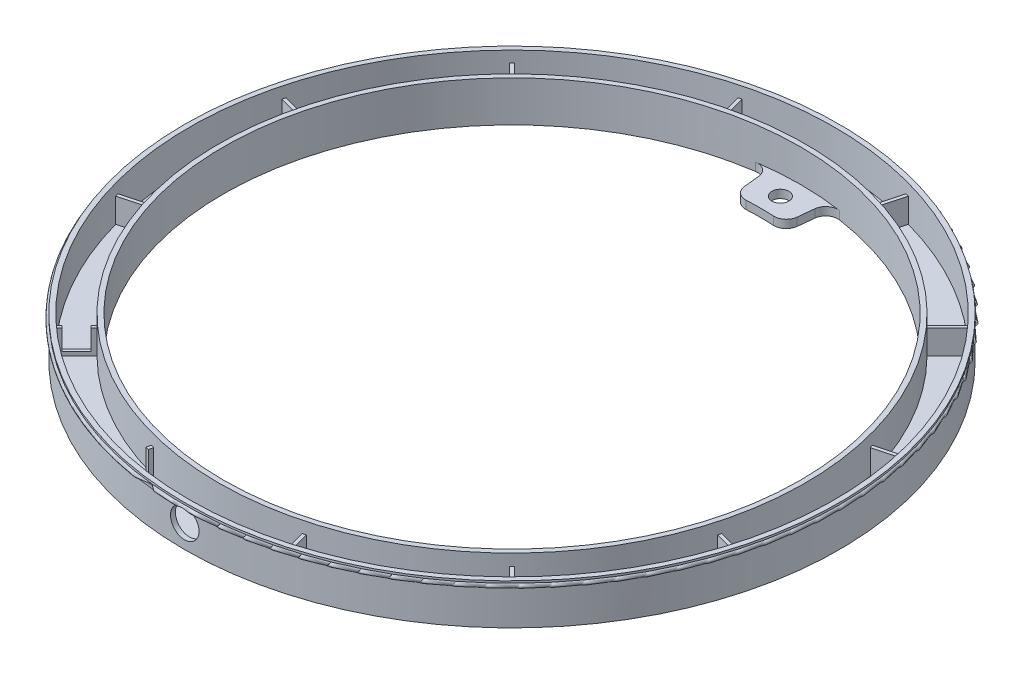
from build123d import *

# Parameters (mm, degrees)
RING_BASE_R         = 80.34
RING_BASE_R_2       = 70.79
BOSS_EXTRUDE1_DEPTH = 10
CUT_EXTRUDE1_START  = 1.2
CHANNEL_R           = 79.14
CHANNEL_R_2         = 71.99
CUT_EXTRUDE1_DEPTH  = 10
BOSS_EXTRUDE2_DEPTH = 6
CRVPATTERN2_COUNT   = 12
BOSS_EXTRUDE3_DEPTH = 2
SKETCH7_R           = 2.1
CUT_EXTRUDE3_DEPTH  = 2
FILLET1_R           = 3
FILLET2_R           = 3
CUT_EXTRUDE4_START  = 78
CUT_EXTRUDE4_DEPTH  = 4
SKETCH16_W          = 5
SKETCH16_H          = 5
CUT_EXTRUDE5_DEPTH  = 3
SKETCH17_W          = 5
SKETCH17_H          = 5
CUT_EXTRUDE6_DEPTH  = 3


with BuildPart() as part:
    # Ring Base → Boss-Extrude1 (new body)
    with BuildSketch(Plane(origin=(0, 0, 0), x_dir=(1, 0, 0), z_dir=(0, 1, 0))):
        with Locations(Location((0, 0, 0), (0, 0, 270))):
            Circle(RING_BASE_R)
        with Locations(Location((0, 0, 0), (0, 0, 270))):
            Circle(RING_BASE_R_2, mode=Mode.SUBTRACT)
    extrude(amount=BOSS_EXTRUDE1_DEPTH)

    # Channel → Cut-Extrude1 (cut)
    with BuildSketch(Plane(origin=(0, 0, 0), x_dir=(1, 0, 0), z_dir=(0, 1, 0)).offset(CUT_EXTRUDE1_START)):
        with Locations(Location((0, 0, 0), (0, 0, 270))):
            Circle(CHANNEL_R)
        with Locations(Location((0, 0, 0), (0, 0, 270))):
            Circle(CHANNEL_R_2, mode=Mode.SUBTRACT)
    extrude(amount=CUT_EXTRUDE1_DEPTH, mode=Mode.SUBTRACT)

    # Sketch3 → Boss-Extrude2 (add)
    with BuildSketch(Plane(origin=(0, 1.2, 0), x_dir=(1, 0, 0), z_dir=(0, 1, 0))):
        with BuildLine():
            Line((-20.201134269, 76.937140785), (-18.093262133, 69.070454876))
            Line((-18.093262133, 69.070454876), (-18.866002794, 68.86339964))
            Line((-18.866002794, 68.86339964), (-20.97387493, 76.730085549))
            Line((-20.97387493, 76.730085549), (-21.179634689, 77.497991422))
            ThreePointArc((-21.179634689, 77.497991422), (-20.793522084, 77.602480884), (-20.406894028, 77.705046658))
            Line((-20.406894028, 77.705046658), (-20.201134269, 76.937140785))
        make_face()
    boss_extrude2 = extrude(amount=BOSS_EXTRUDE2_DEPTH)

    # CrvPattern2: Boss-Extrude2 ×12 about axis
    crvpattern2_axis = Axis((0, 10, 0), (0, 1, 0))
    for i in range(1, CRVPATTERN2_COUNT):
        add(boss_extrude2.rotate(crvpattern2_axis, i * 360 / CRVPATTERN2_COUNT))

    # Sketch6 → Boss-Extrude3 (add)
    with BuildSketch(Plane(origin=(0, 0, 0), x_dir=(1, 0, 0), z_dir=(0, 1, 0))):
        with BuildLine():
            Line((6.196021971, 60.551228328), (7.213975862, 70.499281901))
            ThreePointArc((7.213975862, 70.499281901), (0.013651853, 70.86741148), (-7.186813453, 70.50205606))
            Line((-7.186813453, 70.50205606), (-6.172692411, 60.55361103))
            ThreePointArc((-6.172692411, 60.55361103), (0.01172546, 60.867411665), (6.196021971, 60.551228328))
        make_face()
    extrude(amount=BOSS_EXTRUDE3_DEPTH)

    # Sketch7 → Cut-Extrude3 (cut)
    with BuildSketch(Plane(origin=(0, 2, 0), x_dir=(1, 0, 0), z_dir=(0, 1, 0))):
        with Locations(Location((0.00586273, 65.828705833, 0), (0, 0, 270))):
            Circle(SKETCH7_R)
    extrude(amount=-CUT_EXTRUDE3_DEPTH, mode=Mode.SUBTRACT)

    # Fillet1
    fillet1_edges = [part.edges().sort_by_distance(p)[0] for p in [
        (-6.172692411, 1, -60.55361103),
        (6.196021971, 1, -60.551228328),
    ]]
    fillet(fillet1_edges, radius=FILLET1_R)

    # Fillet2
    fillet2_edges = [part.edges().sort_by_distance(p)[0] for p in [
        (-7.178962859, 1, -70.425042366),
        (7.206095596, 1, -70.422271238),
    ]]
    fillet(fillet2_edges, radius=FILLET2_R)

    # Sweep1: sweep along a curve in space
    with BuildLine() as sweep1_path:
        ThreePointArc((0, 10, 80.34), (56.808958801, 10, 56.808958801), (80.34, 10, 0))
        ThreePointArc((80.34, 10, 0), (56.808958801, 10, -56.808958801), (0, 10, -80.34))
        ThreePointArc((0, 10, -80.34), (-56.808958801, 10, -56.808958801), (-80.34, 10, 0))
        ThreePointArc((-80.34, 10, 0), (-56.808958801, 10, 56.808958801), (0, 10, 80.34))
    # Sketch13 → Sweep1 (sweep)
    with BuildSketch(Plane.XY):
        with BuildLine():
            Line((-80.34, 9.5), (-80.34, 8.5))
            ThreePointArc((-80.34, 8.5), (-80.84, 9), (-80.34, 9.5))
        make_face()
    sweep(path=sweep1_path.line)

    # Cut-Extrude4: read off the stored shape, not the designer's step
    # Cut-Extrude4 outline → Cut-Extrude4 (cut)
    with BuildSketch(Plane.XY.offset(CUT_EXTRUDE4_START)):
        with BuildLine():
            add(Edge.make_bspline(
                [(-3.5, 5.6), (-3.5, 4.674971243), (-3.120421721, 3.770555402), (-1.828870121, 2.479241546), (-0.915010795, 2.100488124), (0.911272738, 2.099512874), (1.819919195, 2.470823008), (3.127363124, 3.776965602), (3.499674295, 4.685065061), (3.500325261, 6.512441328), (3.122041036, 7.4264528), (1.832502447, 8.718494002), (0.92699326, 9.099066808), (-0.919933012, 9.100929631), (-1.826268625, 8.72244788), (-3.119534317, 7.431240973), (-3.5, 6.525028757), (-3.5, 5.6)],
                knots=[0, 0, 0, 0, 0.125, 0.125, 0.25, 0.25, 0.375, 0.375, 0.5, 0.5, 0.625, 0.625, 0.75, 0.75, 0.875, 0.875, 1, 1, 1, 1], degree=3))
        make_face()
    extrude(amount=CUT_EXTRUDE4_DEPTH, mode=Mode.SUBTRACT)

    # Sketch16 → Cut-Extrude5 (cut)
    with BuildSketch(Plane(origin=(0.386370331, 0, 0.103527618), x_dir=(0.2588190451025204, 0, -0.9659258262890684), z_dir=(0.9659258262890684, 0, 0.2588190451025204))):
        with Locations((-75.563938926, 4.7)):
            Rectangle(SKETCH16_W, SKETCH16_H)
    extrude(amount=-CUT_EXTRUDE5_DEPTH, mode=Mode.SUBTRACT)

    # Sketch17 → Cut-Extrude6 (cut)
    with BuildSketch(Plane(origin=(0.282842712, 0, 0.282842712), x_dir=(0.7071067811865475, 0, -0.7071067811865477), z_dir=(0.7071067811865477, 0, 0.7071067811865475))):
        with Locations((-75.563938926, 4.7)):
            Rectangle(SKETCH17_W, SKETCH17_H)
    extrude(amount=-CUT_EXTRUDE6_DEPTH, mode=Mode.SUBTRACT)


solid = part.part
